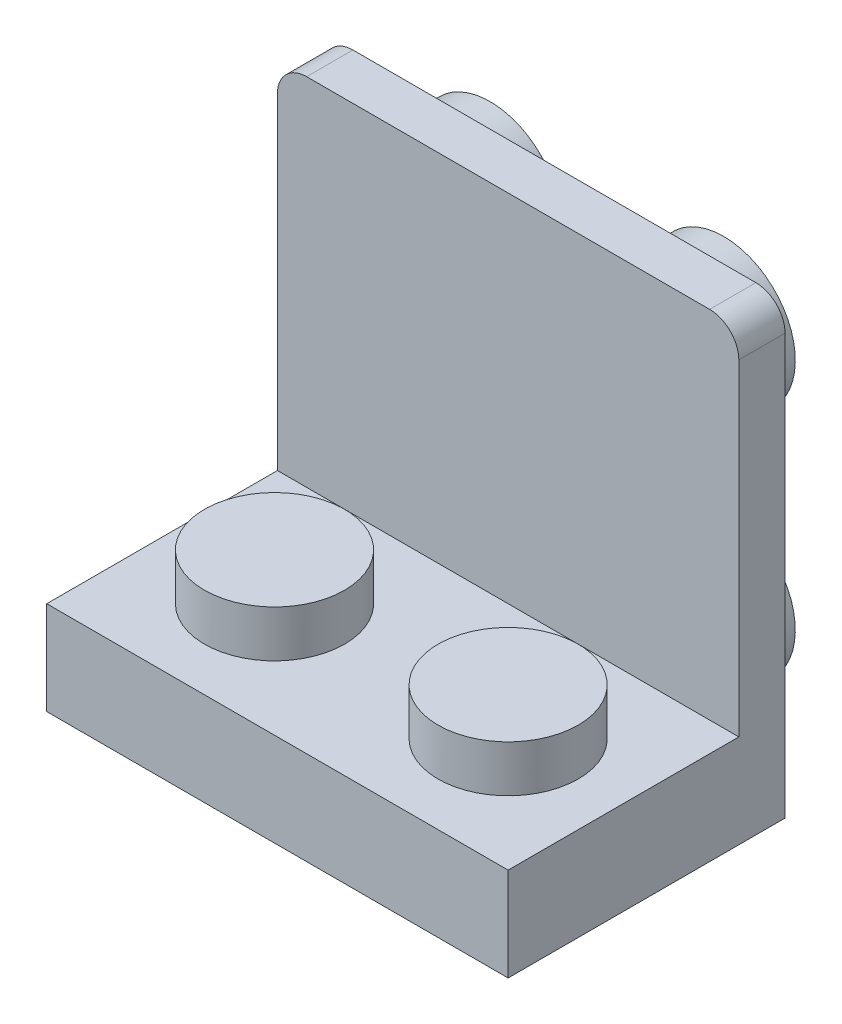
from build123d import *

# Parameters (mm, degrees)
MAINBASESKETCH_W                       = 15.8
MAINBASESKETCH_H                       = 3.2
MAINBASEEXTRUDE_DEPTH                  = 7.9
STUDSSKETCH_R                          = 2.4
STUDSEXTRUDE_DEPTH                     = 1.6
STUDSPATTERN_COUNT                     = 2
STUDSPATTERN_PITCH                     = 8
STUDSPATTERN_COUNT_DIR2                = 2
STUDSPATTERN_PITCH_DIR2                = 8
MAINBASESHELL_T                        = -1.2
LCUTBLUE_DEPTH                         = 19.555463972
LCUTBLUE_DEPTH_BACK                    = 19.555463972
CUTADDEDTOLCUT_DEPTH                   = 2
MADESLIMCUTSKETCH_W                    = 7.9
MADESLIMCUTSKETCH_H                    = 7.9
MADESLIMCUT_DEPTH                      = 19.897228453
MADESLIMFILLEXT_REACH                  = 20.897
SKETCH33_W                             = 5.500952983
SKETCH33_H                             = 1.199047018
SLIMHOLEEXT_START                      = -0.2
SLIMHOLESKETCH_R                       = 1.25
SLIMHOLESKETCH_R_2                     = 0.75
SLIMHOLEEXT_DEPTH                      = 2
ANGLEDSLIMBASESWEEP_START              = 0.681967213
ANGLEDSLIMBASESWEEP_OUTLINE_W          = 7.9
ANGLEDSLIMBASESWEEP_OUTLINE_H          = 1.583745828
ANGLEDSLIMBASESWEEP_DEPTH              = 15.8
SHORTLEXTENDEDCUT_START                = -2
SHORTLEXTENDEDCUTSKETCH_W              = 13.4
SHORTLEXTENDEDCUTSKETCH_H              = 1.582792846
SHORTLEXTENDEDCUT_DEPTH                = 2
SHORTLUNDERSTUMPS_START                = -0.2
SHORTLUNDERSTUMPSKETCH_W               = 0.996828098
SHORTLUNDERSTUMPSKETCH_H               = 1.1
SHORTLUNDERSTUMPS_DEPTH                = 1.5
SHORTLUPPERCIRCLES_START               = -0.2
SHORTLUPPERCIRCLESSKETCH_R             = 2.45
SHORTLUPPERCIRCLESSKETCH_R_2           = 2
SHORTLUPPERCIRCLES_DEPTH               = 2
HOLESBASEHOLESHORT_START               = 0.681967213
HOLESBASEHOLESHORT_OUTLINE_W           = 7.48
HOLESBASEHOLESHORT_OUTLINE_H           = 1.583745828
HOLESBASEHOLESHORT_DEPTH               = 15.8
F_4UPPERCIRCLESTALLERLBASE_START       = -3.383745828
F_4UPPERCIRCLESTALLERLBASE_OUTLINE_R   = 2.45
F_4UPPERCIRCLESTALLERLBASE_OUTLINE_R_2 = 2
F_4UPPERCIRCLESTALLERLBASE_DEPTH       = 1.8
TALLERLBASEOUTERCHAMFER_R              = 1


# Read off the part's stored shape, not the designer's step: AngledSlimBaseSweep, HolesBaseHoleShort, 4UpperCirclesTallerLBase
with BuildPart() as part:
    # MainBaseSketch → MainBaseExtrude (new, symmetric)
    with BuildSketch(Plane.XY):
        with Locations((8.581967213, 1.6)):
            Rectangle(MAINBASESKETCH_W, MAINBASESKETCH_H)
    extrude(amount=MAINBASEEXTRUDE_DEPTH, both=True)

    # StudsSketch → StudsExtrude (add)
    with BuildSketch(Plane(origin=(0, 3.2, 0), x_dir=(1, 0, 0), z_dir=(0, 1, 0))):
        with Locations((4.581967213, 4)):
            Circle(STUDSSKETCH_R)
    studsextrude = extrude(amount=STUDSEXTRUDE_DEPTH)

    # StudsPattern: StudsExtrude 2 × 2
    with Locations(*[(j * STUDSPATTERN_PITCH_DIR2, 0, i * STUDSPATTERN_PITCH) for i in range(STUDSPATTERN_COUNT) for j in range(STUDSPATTERN_COUNT_DIR2) if (i, j) != (0, 0)]):
        add(studsextrude)

    # MainBaseShell
    mainbaseshell_openings = [part.faces().sort_by_distance(p)[0] for p in [
        (8.581967213, 0, 0),
    ]]
    offset(amount=MAINBASESHELL_T, openings=mainbaseshell_openings, kind=Kind.INTERSECTION)

    # LCUTBlueSketch → LCutBlue (cut, two sides: drawn at the far end of the back side and taken through both)
    with BuildSketch(Plane(origin=(0, 3.2, 0), x_dir=(1, 0, 0), z_dir=(0, 1, 0)).offset(-LCUTBLUE_DEPTH_BACK)):
        Polygon((8.581967213, 53.229874044), (8.581967213, 7.9), (8.581967213, 0), (16.481967213, 0), (61.811841258, 0), (125.917963912, 64.106122654), (72.688089868, 117.335996699), align=None)
    extrude(amount=LCUTBLUE_DEPTH + LCUTBLUE_DEPTH_BACK, mode=Mode.SUBTRACT)

    # CutAddedtoLSketch → CutAddedToLCut (add)
    with BuildSketch(Plane.XZ):
        Polygon((7.382920196, -6.7), (8.581967213, -6.7), (8.581967213, 0), (15.281967213, 0), (15.281967213, 1.199047018), (7.382920196, 1.199047018), (7.382920196, 0), align=None)
    extrude(amount=-CUTADDEDTOLCUT_DEPTH)

    # MadeSlimCutSketch → MadeSlimCut (cut, through all)
    with BuildSketch(Plane.XZ):
        with Locations((4.631967213, -3.95)):
            Rectangle(MADESLIMCUTSKETCH_W, MADESLIMCUTSKETCH_H)
    extrude(amount=-MADESLIMCUT_DEPTH, mode=Mode.SUBTRACT)

    # Sketch33 → MadeSlimFillExt (add, up to next)
    with BuildSketch(Plane.XZ, mode=Mode.PRIVATE) as madeslimfillext_sk1:
        with Locations((4.632443704, 0.599523509)):
            Rectangle(SKETCH33_W, SKETCH33_H)
    madeslimfillext_tool1 = extrude(madeslimfillext_sk1.sketch, amount=-MADESLIMFILLEXT_REACH, mode=Mode.PRIVATE) - part.part
    add(madeslimfillext_tool1.solids().sort_by_distance((4.632444, 0, 0.599524))[0])

    # SlimHoleSketch → SlimHoleExt (add)
    with BuildSketch(Plane.XZ.offset(-2).offset(SLIMHOLEEXT_START)):
        with Locations((8.581967213, 4)):
            Circle(SLIMHOLESKETCH_R)
        with Locations((8.581967213, 4)):
            Circle(SLIMHOLESKETCH_R_2, mode=Mode.SUBTRACT)
    extrude(amount=SLIMHOLEEXT_DEPTH)

    # AngledSlimBaseSweep outline → AngledSlimBaseSweep (add)
    with BuildSketch(Plane.YZ.offset(ANGLEDSLIMBASESWEEP_START)):
        with Locations((3.95, -0.791872914)):
            Rectangle(ANGLEDSLIMBASESWEEP_OUTLINE_W, ANGLEDSLIMBASESWEEP_OUTLINE_H)
    extrude(amount=ANGLEDSLIMBASESWEEP_DEPTH)

    # ShortLExtendedCutSketch → ShortLExtendedCut (cut)
    with BuildSketch(Plane.XZ.offset(SHORTLEXTENDEDCUT_START)):
        with Locations((8.581967213, 0.407650595)):
            Rectangle(SHORTLEXTENDEDCUTSKETCH_W, SHORTLEXTENDEDCUTSKETCH_H)
    extrude(amount=SHORTLEXTENDEDCUT_DEPTH, mode=Mode.SUBTRACT)

    # ShortLUnderStumpSketch → ShortLUnderStumps (add)
    with BuildSketch(Plane.XZ.offset(-2).offset(SHORTLUNDERSTUMPS_START)):
        with Locations((4.581764801, 0.166254172)):
            Rectangle(SHORTLUNDERSTUMPSKETCH_W, SHORTLUNDERSTUMPSKETCH_H)
        with Locations((8.57767054, 0.166254172)):
            Rectangle(SHORTLUNDERSTUMPSKETCH_W, SHORTLUNDERSTUMPSKETCH_H)
        with Locations((12.582169625, 0.166254172)):
            Rectangle(SHORTLUNDERSTUMPSKETCH_W, SHORTLUNDERSTUMPSKETCH_H)
    extrude(amount=SHORTLUNDERSTUMPS_DEPTH)

    # ShortLUpperCirclesSketch → ShortLUpperCircles (add)
    # profile 1 of 2: a face of its own
    with BuildSketch(Plane(origin=(0, 0, -1.583745828), x_dir=(-1, 0, 0), z_dir=(0, 0, -1)).offset(SHORTLUPPERCIRCLES_START)):
        with Locations(Location((-12.581967213, 3.95, 0), (0, 0, 90))):
            Circle(SHORTLUPPERCIRCLESSKETCH_R)
        with Locations(Location((-12.581967213, 3.95, 0), (0, 0, 90))):
            Circle(SHORTLUPPERCIRCLESSKETCH_R_2, mode=Mode.SUBTRACT)
    # profile 2 of 2: a face of its own
    with BuildSketch(Plane(origin=(0, 0, -1.583745828), x_dir=(-1, 0, 0), z_dir=(0, 0, -1)).offset(SHORTLUPPERCIRCLES_START)):
        with Locations(Location((-4.581967213, 3.95, 0), (0, 0, 270))):
            Circle(SHORTLUPPERCIRCLESSKETCH_R)
        with Locations(Location((-4.581967213, 3.95, 0), (0, 0, 270))):
            Circle(SHORTLUPPERCIRCLESSKETCH_R_2, mode=Mode.SUBTRACT)
    extrude(amount=SHORTLUPPERCIRCLES_DEPTH)

    # HolesBaseHoleShort outline → HolesBaseHoleShort (add)
    with BuildSketch(Plane.YZ.offset(HOLESBASEHOLESHORT_START)):
        with Locations((11.64, -0.791872914)):
            Rectangle(HOLESBASEHOLESHORT_OUTLINE_W, HOLESBASEHOLESHORT_OUTLINE_H)
    extrude(amount=HOLESBASEHOLESHORT_DEPTH)

    # 4UpperCirclesTallerLBase outline → 4UpperCirclesTallerLBase (add)
    # profile 1 of 2: a face of its own
    with BuildSketch(Plane.XY.offset(F_4UPPERCIRCLESTALLERLBASE_START)):
        with Locations((4.581967213, 11.95)):
            Circle(F_4UPPERCIRCLESTALLERLBASE_OUTLINE_R)
        with Locations((4.581967213, 11.95)):
            Circle(F_4UPPERCIRCLESTALLERLBASE_OUTLINE_R_2, mode=Mode.SUBTRACT)
    # profile 2 of 2: a face of its own
    with BuildSketch(Plane.XY.offset(F_4UPPERCIRCLESTALLERLBASE_START)):
        with Locations((12.581967213, 11.95)):
            Circle(F_4UPPERCIRCLESTALLERLBASE_OUTLINE_R)
        with Locations((12.581967213, 11.95)):
            Circle(F_4UPPERCIRCLESTALLERLBASE_OUTLINE_R_2, mode=Mode.SUBTRACT)
    extrude(amount=F_4UPPERCIRCLESTALLERLBASE_DEPTH)

    # TallerLBaseOuterChamfer
    tallerlbaseouterchamfer_edges = [part.edges().sort_by_distance(p)[0] for p in [
        (16.481967213, 15.38, -0.791872914),
        (0.681967213, 15.38, -0.791872914),
    ]]
    fillet(tallerlbaseouterchamfer_edges, radius=TALLERLBASEOUTERCHAMFER_R)


solid = part.part
